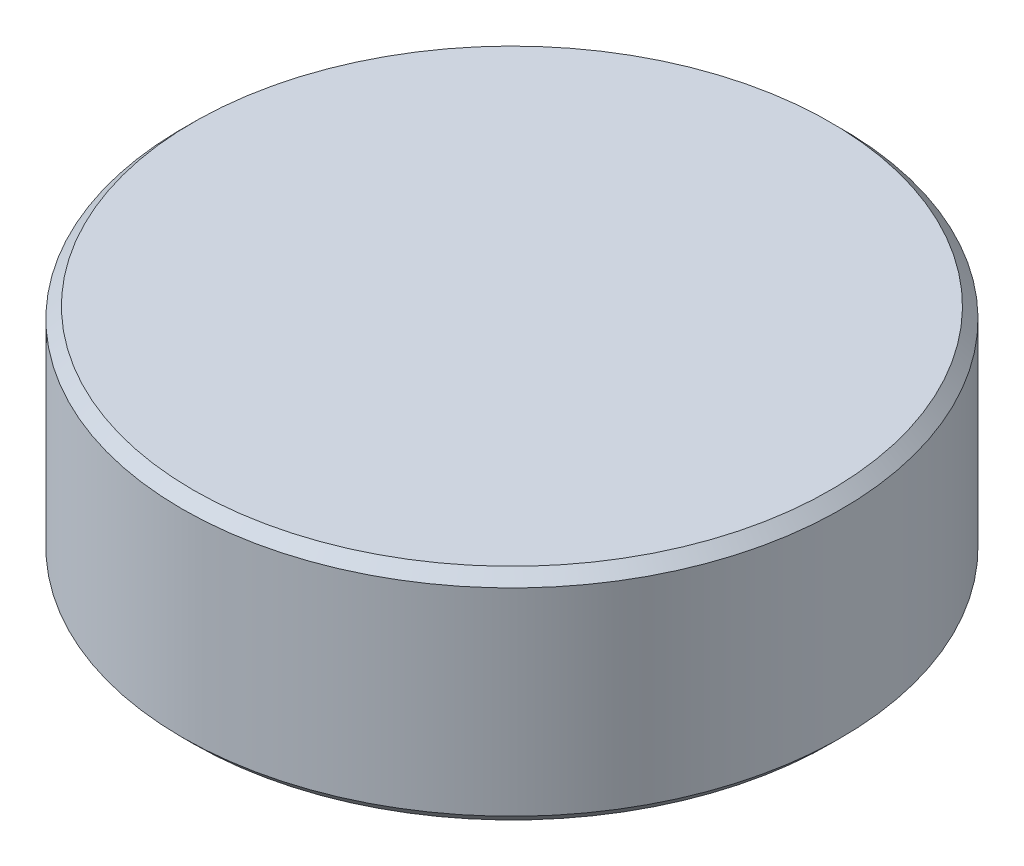
from build123d import *

# Parameters (mm, degrees)
SKETCH1_R           = 3
BOSS_EXTRUDE1_DEPTH = 2
CHAMFER1_SIZE       = 0.1


with BuildPart() as part:
    # Sketch1 → Boss-Extrude1 (new body)
    with BuildSketch(Plane(origin=(0, 0, 0), x_dir=(1, 0, 0), z_dir=(0, 1, 0))):
        Circle(SKETCH1_R)
    extrude(amount=BOSS_EXTRUDE1_DEPTH)

    # Chamfer1
    chamfer1_edges = [part.edges().sort_by_distance(p)[0] for p in [
        (-3, 0, 0),
        (-3, 2, 0),
    ]]
    chamfer(chamfer1_edges, length=CHAMFER1_SIZE)


solid = part.part
